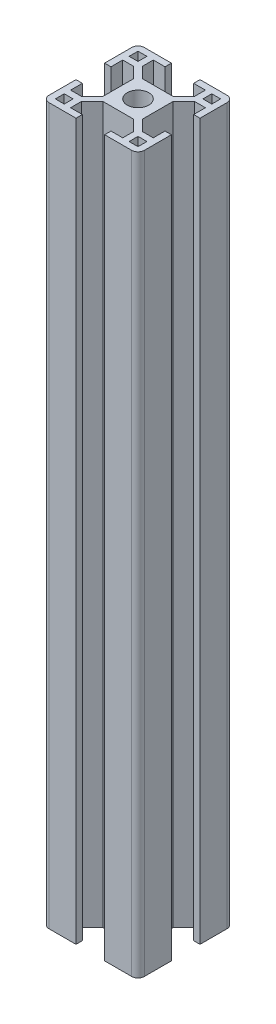
from build123d import *

# Parameters (mm, degrees)
SKETCH1_W           = 20
SKETCH1_H           = 20
EXTRUDE1_DEPTH      = 150
SKETCH2_R           = 2.266666667
SKETCH2_W           = 1.866666667
SKETCH2_H           = 1.866666667
EXTRUDE2_DEPTH      = 151.665191733
FILLET1_R           = 1.333333333
SKETCH_3_W          = 5
SKETCH_3_H          = 5
CUT_EXTRUDE_1_DEPTH = 10


with BuildPart() as part:
    # Sketch1 → Extrude1 (new body)
    with BuildSketch(Plane(origin=(0, 0, 0), x_dir=(1, 0, 0), z_dir=(0, 1, 0))):
        Rectangle(SKETCH1_W, SKETCH1_H)
    extrude(amount=EXTRUDE1_DEPTH)

    # Sketch2 → Extrude2 (cut, through all)
    with BuildSketch(Plane(origin=(0, 150, 0), x_dir=(1, 0, 0), z_dir=(0, 1, 0))):
        Circle(SKETCH2_R)
        Polygon((8.666666667, 3), (11.333333333, 3), (11.333333333, -3), (8.666666667, -3), (8.666666667, -5.466666667), (6.409475708, -5.466666667), (4.133333333, -3.190524292), (4.133333333, 3.190524292), (6.409475708, 5.466666667), (8.666666667, 5.466666667), align=None)
        with Locations((7.733333334, 7.733333334)):
            Rectangle(SKETCH2_W, SKETCH2_H)
        Polygon((-3.190524292, 4.133333333), (-5.466666667, 6.409475708), (-5.466666667, 8.666666667), (-3, 8.666666667), (-3, 11.333333333), (3, 11.333333333), (3, 8.666666667), (5.466666667, 8.666666667), (5.466666667, 6.409475708), (3.190524292, 4.133333333), align=None)
        with Locations((7.733333334, -7.733333334)):
            Rectangle(SKETCH2_W, SKETCH2_H)
        with Locations((-7.733333334, 7.733333334)):
            Rectangle(SKETCH2_W, SKETCH2_H)
        with Locations((-7.733333334, -7.733333334)):
            Rectangle(SKETCH2_W, SKETCH2_H)
        Polygon((-6.409475708, -5.466666667), (-8.666666667, -5.466666667), (-8.666666667, -3), (-11.333333333, -3), (-11.333333333, 3), (-8.666666667, 3), (-8.666666667, 5.466666667), (-6.409475708, 5.466666667), (-4.133333333, 3.190524292), (-4.133333333, -3.190524292), align=None)
        Polygon((3.190524292, -4.133333333), (-3.190524292, -4.133333333), (-5.466666667, -6.409475708), (-5.466666667, -8.666666667), (-3, -8.666666667), (-3, -11.333333333), (3, -11.333333333), (3, -8.666666667), (5.466666667, -8.666666667), (5.466666667, -6.409475708), align=None)
    extrude(amount=-EXTRUDE2_DEPTH, mode=Mode.SUBTRACT)

    # Fillet1
    fillet1_edges = [part.edges().sort_by_distance(p)[0] for p in [
        (10, 75, 10),
        (10, 75, -10),
        (-10, 75, 10),
        (-10, 75, -10),
    ]]
    fillet(fillet1_edges, radius=FILLET1_R)

    # Эскиз3 → Вырез-Вытянуть1 (cut, symmetric)
    with BuildSketch(Plane.XY):
        with Locations((0, 75)):
            Rectangle(SKETCH_3_W, SKETCH_3_H)
    extrude(amount=CUT_EXTRUDE_1_DEPTH, both=True, mode=Mode.SUBTRACT)


solid = part.part
